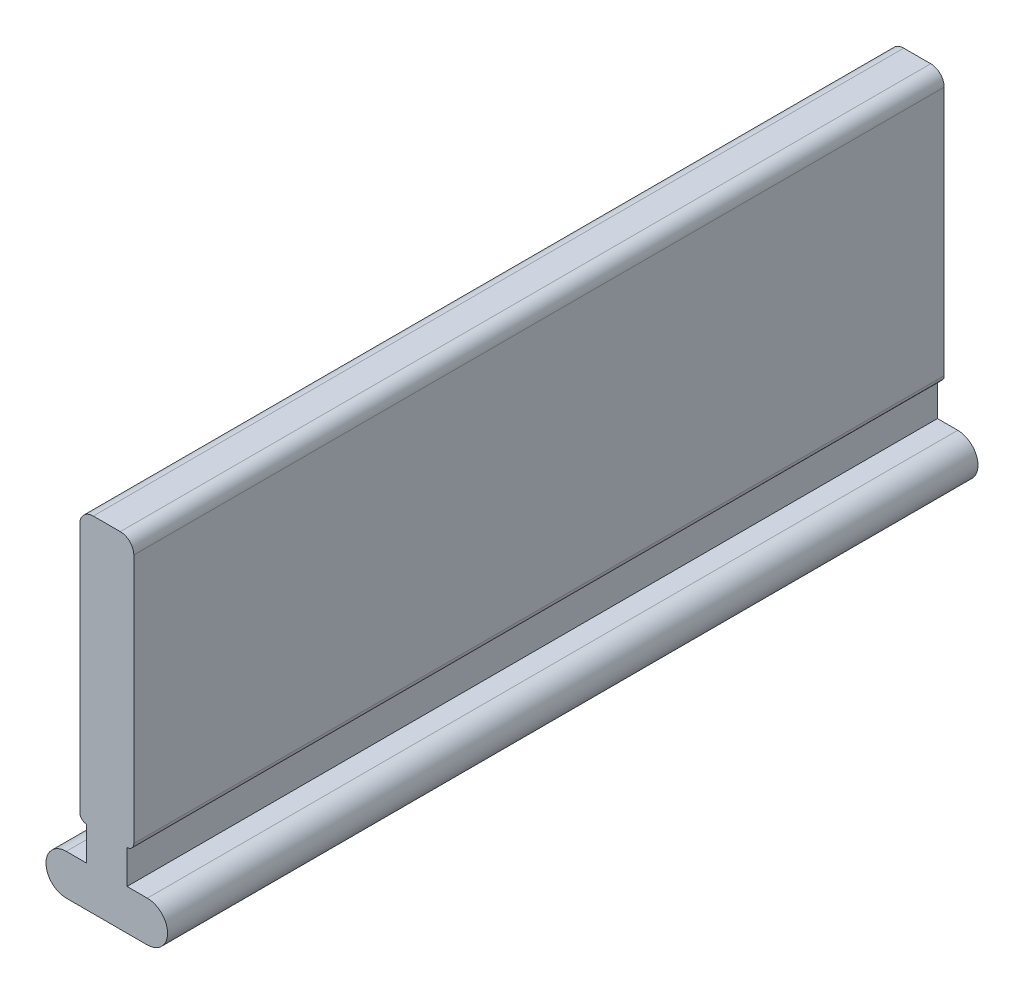
from build123d import *

# Parameters (mm, degrees)
BOSS_EXTRUDE1_DEPTH = 60
CUT_EXTRUDE1_DEPTH  = 60
FILLET19_R          = 0.5
FILLET20_R          = 0.5
FILLET22_R          = 1


with BuildPart() as part:
    # Sketch1 → Boss-Extrude1 (new body)
    with BuildSketch(Plane.XY):
        Polygon((-2, 3), (-2, 23), (2, 23), (2, 3), (6, 3), (6, -3), (-6, -3), (-6, 3), align=None)
    extrude(amount=BOSS_EXTRUDE1_DEPTH)

    # Sketch2 → Cut-Extrude1 (cut)
    with BuildSketch(Plane.XY.offset(60)):
        with BuildLine():
            Line((-6, -3), (6, -3))
            Line((6, -3), (6, 3))
            Line((6, 3), (1.5, 3))
            Line((1.5, 3), (1.5, 0.5))
            Line((1.5, 0.5), (3, 0.5))
            ThreePointArc((3, 0.5), (4.5, -1), (3, -2.5))
            Line((3, -2.5), (-3, -2.5))
            ThreePointArc((-3, -2.5), (-4.5, -1), (-3, 0.5))
            Line((-3, 0.5), (-1.5, 0.5))
            Line((-1.5, 0.5), (-1.5, 3))
            Line((-1.5, 3), (-6, 3))
            Line((-6, 3), (-6, -3))
        make_face()
    extrude(amount=-CUT_EXTRUDE1_DEPTH, mode=Mode.SUBTRACT)

    # Fillet19
    fillet19_edges = [part.edges().sort_by_distance(p)[0] for p in [
        (-2, 3, 30),
    ]]
    fillet(fillet19_edges, radius=FILLET19_R - 0.0001)  # a hair under: the kernel refuses the full size

    # Fillet20
    fillet20_edges = [part.edges().sort_by_distance(p)[0] for p in [
        (2, 3, 30),
    ]]
    fillet(fillet20_edges, radius=FILLET20_R - 0.0001)  # a hair under: the kernel refuses the full size

    # Fillet22
    fillet22_edges = [part.edges().sort_by_distance(p)[0] for p in [
        (-2, 23, 30),
        (2, 23, 30),
    ]]
    fillet(fillet22_edges, radius=FILLET22_R)


solid = part.part
